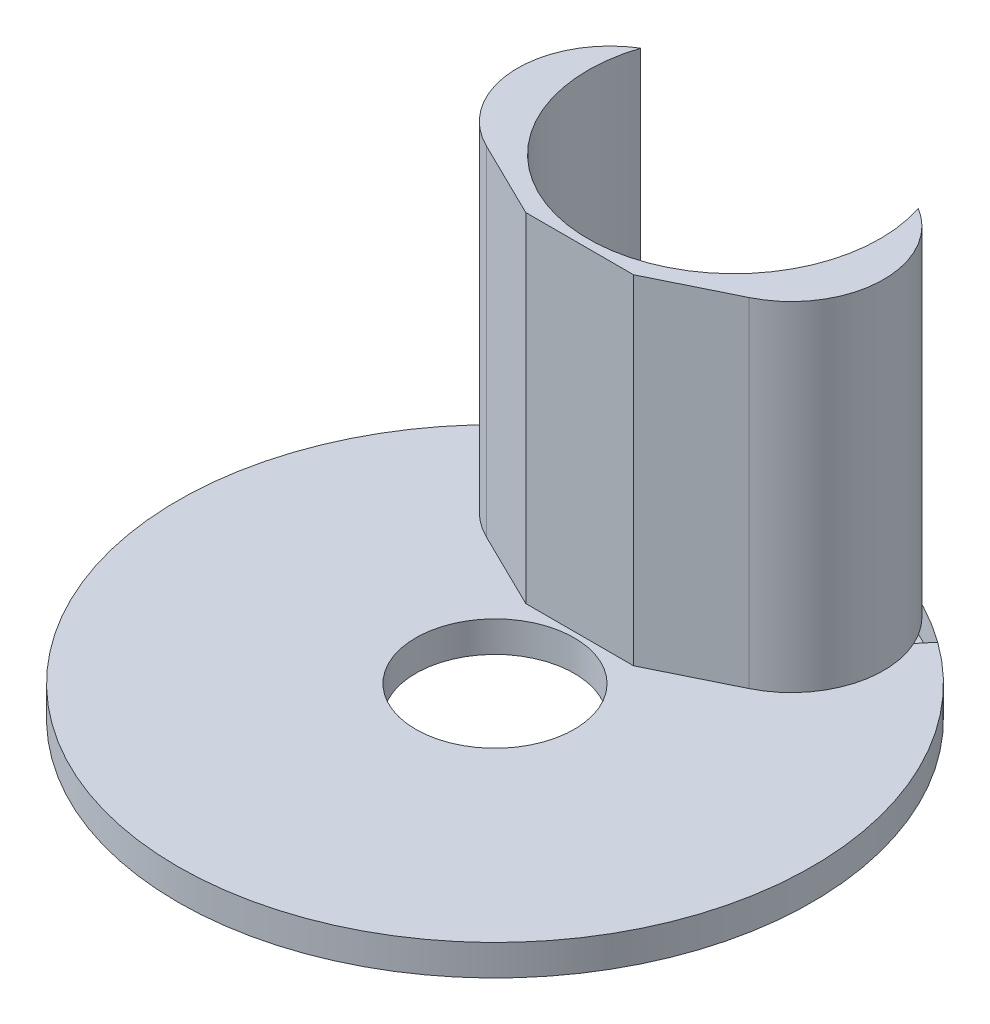
from build123d import *

# Parameters (mm, degrees)
SKETCH1_R           = 20.6
BOSS_EXTRUDE1_DEPTH = 2
SKETCH2_R           = 5.15
CUT_EXTRUDE1_DEPTH  = 3
SKETCH3_R           = 6.5
CUT_EXTRUDE2_DEPTH  = 2
BOSS_EXTRUDE4_DEPTH = 22
FILLET2_R           = 6


with BuildPart() as part:
    # Sketch1 → Boss-Extrude1 (new body)
    with BuildSketch(Plane(origin=(0, 0, 0), x_dir=(1, 0, 0), z_dir=(0, 1, 0))):
        with Locations(Location((0, 0, 0), (0, 0, 270))):
            Circle(SKETCH1_R)
    extrude(amount=BOSS_EXTRUDE1_DEPTH)

    # Sketch2 → Cut-Extrude1 (cut)
    with BuildSketch(Plane(origin=(0, 2, 0), x_dir=(1, 0, 0), z_dir=(0, 1, 0))):
        with Locations(Location((0, 0, 0), (0, 0, 270))):
            Circle(SKETCH2_R)
    extrude(amount=-CUT_EXTRUDE1_DEPTH, mode=Mode.SUBTRACT)

    # Sketch3 → Cut-Extrude2 (cut)
    with BuildSketch(Plane(origin=(0, 2, 0), x_dir=(1, 0, 0), z_dir=(0, 1, 0))):
        with Locations(Location((0, 13, 0), (0, 0, 270))):
            Circle(SKETCH3_R)
    extrude(amount=-CUT_EXTRUDE2_DEPTH, mode=Mode.SUBTRACT)

    # Sketch4 → Boss-Extrude4 (add)
    with BuildSketch(Plane(origin=(0, 2, 0), x_dir=(1, 0, 0), z_dir=(0, 1, 0))):
        with BuildLine():
            Line((-16.743954133, 12), (-3.5, 5.5))
            Line((-3.5, 5.5), (3.5, 5.5))
            Line((3.5, 5.5), (16.743954133, 12))
            ThreePointArc((16.743954133, 12), (13.279606143, 15.748398671), (9, 18.529975715))
            ThreePointArc((9, 18.529975715), (0, 6.042759079), (-9, 18.529975715))
            ThreePointArc((-9, 18.529975715), (-13.279606143, 15.748398671), (-16.743954133, 12))
        make_face()
    extrude(amount=BOSS_EXTRUDE4_DEPTH)

    # Fillet2
    # the kernel refuses this fillet: 6 mm, written as the material it takes off along each edge
    with BuildSketch(Plane(origin=(16.743954133, 2, -12), x_dir=(-0.7761796310564387, 0, -0.6305118399626535), z_dir=(0, 1, 0))) as fillet2_piece_1:
        with BuildLine():
            CenterArc((9.278744028, 5.78779133), FILLET2_R, 155.229237023, 130.054584679)
            Line((3.830795632, 8.301724161), (0, 0))
            ThreePointArc((0, 0), (5.430174062, -0.728583099), (10.860348123, 0))
        make_face()
    extrude(amount=49.150870308, mode=Mode.SUBTRACT)
    with BuildSketch(Plane(origin=(-16.743954133, 2, -12), x_dir=(0.7761796310564387, 0, -0.6305118399626534), z_dir=(0, 1, 0))) as fillet2_piece_2:
        with BuildLine():
            CenterArc((9.278744028, -5.78779133), FILLET2_R, 74.716178298, 130.054584679)
            Line((3.830795632, -8.301724161), (0, 0))
            ThreePointArc((0, 0), (5.430174062, 0.728583099), (10.860348123, 0))
        make_face()
    extrude(amount=49.150870308, mode=Mode.SUBTRACT)


solid = part.part
